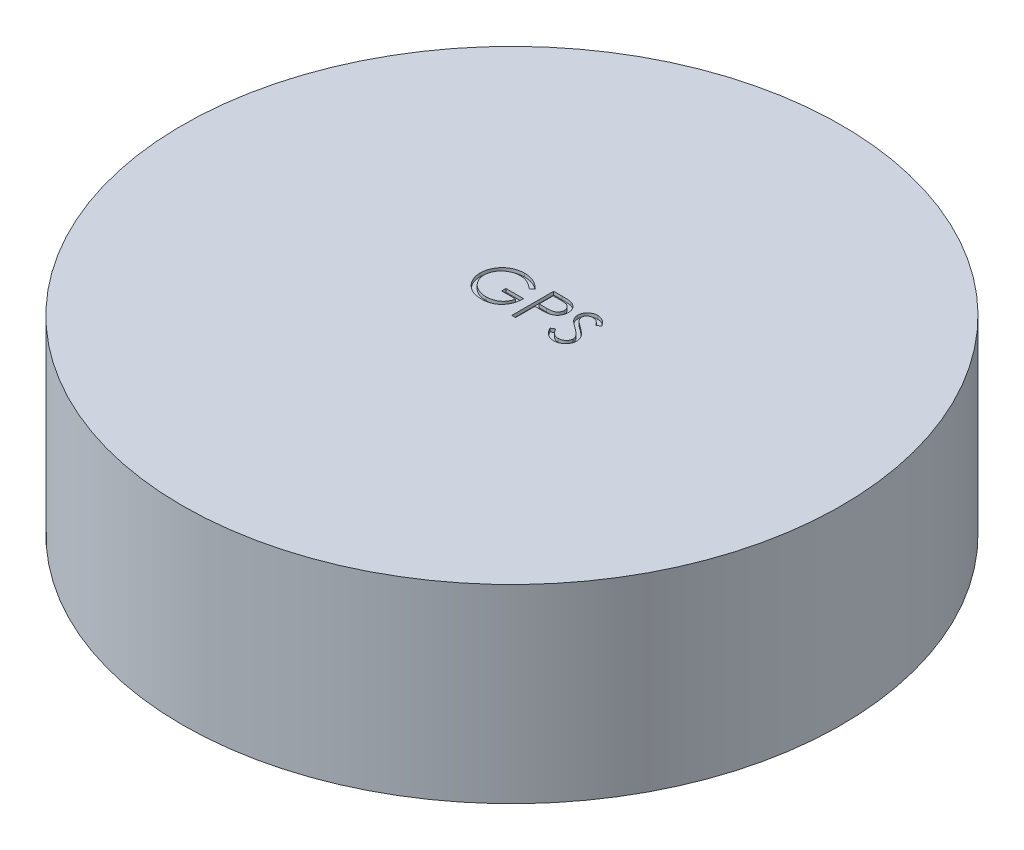
from build123d import *

# Parameters (mm, degrees)
SKETCH1_R           = 25
BOSS_EXTRUDE1_DEPTH = 14.4
CUT_EXTRUDE1_DEPTH  = 0.254


with BuildPart() as part:
    # Sketch1 → Boss-Extrude1 (new body)
    with BuildSketch(Plane(origin=(0, 0, 0), x_dir=(1, 0, 0), z_dir=(0, 1, 0))):
        Circle(SKETCH1_R)
    extrude(amount=BOSS_EXTRUDE1_DEPTH)

    # Sketch2 → Cut-Extrude1 (cut)
    # profile 1 of 3: a face of its own
    with BuildSketch(Plane(origin=(0, 14.4, 0), x_dir=(1, 0, 0), z_dir=(0, 1, 0))):
        with BuildLine():
            Line((-0.861858974, 2.633112981), (-1.106089744, 2.401602564))
            add(Edge.make_bspline(
                [(-1.106089744, 2.401602564), (-1.150284735, 2.443177704), (-1.237620863, 2.525336601), (-1.380006226, 2.631935861), (-1.528563237, 2.723254395), (-1.682516716, 2.797555052), (-1.838054118, 2.856839342), (-1.993110937, 2.899047012), (-2.14609668, 2.925964242), (-2.247848371, 2.92918312), (-2.297986779, 2.930769231)],
                knots=[0, 0, 0, 0, 1.08915593, 2.152340314, 3.188132944, 4.216796309, 5.218260357, 6.173443236, 7.099959455, 8, 8, 8, 8], degree=3))
            add(Edge.make_bspline(
                [(-2.297986779, 2.930769231), (-2.328752257, 2.930394031), (-2.390203421, 2.929644605), (-2.481481898, 2.920079495), (-2.571803062, 2.906322797), (-2.660996409, 2.88641838), (-2.749235362, 2.86119159), (-2.836213028, 2.829636205), (-2.922091657, 2.792846805), (-3.006062316, 2.750335847), (-3.087469773, 2.703636272), (-3.164356331, 2.651885096), (-3.237212057, 2.596740979), (-3.304667586, 2.536823305), (-3.367110934, 2.47267482), (-3.426028386, 2.405488821), (-3.47934779, 2.33342973), (-3.527509061, 2.257823341), (-3.570472815, 2.179997569), (-3.608399236, 2.1007015), (-3.640237309, 2.020198146), (-3.665428172, 1.93838649), (-3.686211408, 1.855899455), (-3.70083238, 1.772165887), (-3.709075335, 1.687096129), (-3.710501164, 1.630130045), (-3.711217949, 1.601492388)],
                knots=[0, 0, 0, 0, 1.02818874, 2.053710826, 3.065248034, 4.081641283, 5.106893873, 6.131558223, 7.173050175, 8.228653731, 9.27666206, 10.308777013, 11.325269123, 12.329503258, 13.32196095, 14.316845687, 15.314881793, 16.315733098, 17.311955233, 18.285320748, 19.252783886, 20.203351036, 21.145449891, 22.095197417, 23.042428769, 24, 24, 24, 24], degree=3))
            add(Edge.make_bspline(
                [(-3.711217949, 1.601492388), (-3.710532404, 1.572218146), (-3.709163187, 1.513749602), (-3.700399898, 1.426487836), (-3.684136422, 1.340522078), (-3.662394286, 1.255569843), (-3.635197404, 1.17148564), (-3.601295057, 1.088634006), (-3.561139833, 1.007018008), (-3.514660961, 0.927373027), (-3.463692048, 0.849791427), (-3.406593681, 0.776712433), (-3.345941581, 0.707162899), (-3.279526115, 0.642687027), (-3.209476958, 0.581560207), (-3.133701251, 0.525466555), (-3.053689019, 0.473325596), (-2.969318191, 0.425794467), (-2.881504238, 0.383332438), (-2.791464184, 0.345573618), (-2.69891038, 0.314477362), (-2.604329225, 0.289133511), (-2.507833472, 0.26835967), (-2.408933308, 0.254995206), (-2.308355922, 0.245297095), (-2.240557306, 0.244588008), (-2.20640024, 0.244230769)],
                knots=[0, 0, 0, 0, 0.93586088, 1.869166235, 2.799637598, 3.729985548, 4.670839027, 5.622275134, 6.589130586, 7.576015415, 8.568469353, 9.55398029, 10.53834874, 11.515998671, 12.510579167, 13.508179873, 14.527009472, 15.561807829, 16.601455013, 17.643573243, 18.680854198, 19.719860599, 20.772568776, 21.833555941, 22.908541556, 24, 24, 24, 24], degree=3))
            add(Edge.make_bspline(
                [(-2.20640024, 0.244230769), (-2.165235597, 0.245091263), (-2.084402131, 0.246780984), (-1.965578715, 0.259934818), (-1.851457358, 0.280478695), (-1.742358731, 0.310564901), (-1.63815612, 0.348940378), (-1.538467523, 0.395200478), (-1.444077804, 0.451119539), (-1.354703211, 0.514232975), (-1.272373478, 0.584550002), (-1.198120094, 0.660427472), (-1.1331274, 0.741497075), (-1.076426709, 0.827281326), (-1.029519572, 0.918490281), (-0.991017894, 1.014676963), (-0.961505551, 1.115884634), (-0.949390681, 1.185817757), (-0.943269231, 1.221153846)],
                knots=[0, 0, 0, 0, 1.13008108, 2.219097802, 3.278683437, 4.311054135, 5.322181354, 6.324827112, 7.324222904, 8.330512327, 9.32562643, 10.293043162, 11.24128371, 12.174520618, 13.111833804, 14.052305215, 15.015860969, 16, 16, 16, 16], degree=3))
            Line((-0.943269231, 1.221153846), (-2.001602564, 1.221153846))
            Line((-2.001602564, 1.221153846), (-2.001602564, 1.546794872))
            Line((-2.001602564, 1.546794872), (-0.658333333, 1.546794872))
            add(Edge.make_bspline(
                [(-0.658333333, 1.546794872), (-0.659880782, 1.486100221), (-0.662909417, 1.367309826), (-0.684153719, 1.194072509), (-0.718458698, 1.030449616), (-0.765321981, 0.876268829), (-0.825987414, 0.731748642), (-0.899803922, 0.59674232), (-0.987952917, 0.472122045), (-1.087294532, 0.356870449), (-1.198782351, 0.254064664), (-1.319403885, 0.163707849), (-1.44935842, 0.087596191), (-1.588523032, 0.025674018), (-1.736442139, -0.022653106), (-1.893458026, -0.056917322), (-2.059357764, -0.077445931), (-2.173056035, -0.080068825), (-2.231204928, -0.081410256)],
                knots=[0, 0, 0, 0, 1.140356446, 2.231883559, 3.274166699, 4.278491846, 5.25512956, 6.21435461, 7.1637429, 8.11826594, 9.068280886, 10.0076534, 10.945064095, 11.891975133, 12.864533718, 13.863980011, 14.907571808, 16, 16, 16, 16], degree=3))
            add(Edge.make_bspline(
                [(-2.231204928, -0.081410256), (-2.267046265, -0.080893982), (-2.337736933, -0.079875723), (-2.442140846, -0.072639129), (-2.543666117, -0.061498892), (-2.642297953, -0.044675816), (-2.738399164, -0.02407038), (-2.831489787, 0.00231543), (-2.921924439, 0.03285775), (-3.009842897, 0.067597396), (-3.094447165, 0.107848828), (-3.176114076, 0.152579715), (-3.255295062, 0.201559407), (-3.331450762, 0.25563496), (-3.404977975, 0.314401906), (-3.475402599, 0.377978032), (-3.543118889, 0.446168976), (-3.585537309, 0.494591364), (-3.606911058, 0.518990385)],
                knots=[0, 0, 0, 0, 1.107784379, 2.184907829, 3.233506516, 4.263428166, 5.276301166, 6.270063455, 7.25232949, 8.225834625, 9.190232166, 10.146266622, 11.1027726, 12.066435141, 13.031522626, 14.010570082, 14.99756817, 16, 16, 16, 16], degree=3))
            add(Edge.make_bspline(
                [(-3.606911058, 0.518990385), (-3.637922582, 0.557698763), (-3.69943087, 0.634473), (-3.778604627, 0.757481521), (-3.846097328, 0.884846065), (-3.900859566, 1.016921192), (-3.943620545, 1.153583364), (-3.974287645, 1.29465795), (-3.992255686, 1.440326615), (-3.994844252, 1.538901533), (-3.996153846, 1.588772035)],
                knots=[0, 0, 0, 0, 1.023165419, 2.029347347, 3.013907458, 3.994755782, 4.975994455, 5.96558838, 6.970761222, 8, 8, 8, 8], degree=3))
            add(Edge.make_bspline(
                [(-3.996153846, 1.588772035), (-3.99567103, 1.626115707), (-3.994711534, 1.700328436), (-3.983076959, 1.810507565), (-3.966384244, 1.918730336), (-3.941848702, 2.024908283), (-3.910918519, 2.12911232), (-3.872316428, 2.23139083), (-3.827372129, 2.331804171), (-3.775133858, 2.42966118), (-3.717000098, 2.523663326), (-3.653908113, 2.61343219), (-3.58496199, 2.697332985), (-3.511287657, 2.776428266), (-3.432006102, 2.849724363), (-3.347860053, 2.917899877), (-3.258784663, 2.98104626), (-3.1644997, 3.038168896), (-3.066412444, 3.08948018), (-2.964758014, 3.134464679), (-2.859567442, 3.171642401), (-2.751628801, 3.203187187), (-2.640125069, 3.226514493), (-2.525865403, 3.243431569), (-2.40825423, 3.255007256), (-2.328755832, 3.255938217), (-2.288446514, 3.256410256)],
                knots=[0, 0, 0, 0, 1.008945113, 2.00506715, 2.99143336, 3.967273523, 4.948097931, 5.927297278, 6.919902385, 7.919676788, 8.923139349, 9.905703106, 10.883022732, 11.856032218, 12.825136022, 13.798837087, 14.781400844, 15.773989409, 16.776158564, 17.77167057, 18.775803737, 19.789618931, 20.80898985, 21.851988756, 22.910860228, 24, 24, 24, 24], degree=3))
            add(Edge.make_bspline(
                [(-2.288446514, 3.256410256), (-2.255573251, 3.255884575), (-2.190389431, 3.254842209), (-2.093392517, 3.247617136), (-1.997894854, 3.236165472), (-1.903754843, 3.220538316), (-1.811293068, 3.199253397), (-1.720246128, 3.173782381), (-1.630482041, 3.144126228), (-1.54228213, 3.108757774), (-1.455053344, 3.068613415), (-1.368310675, 3.023425524), (-1.282350502, 2.972421413), (-1.197023754, 2.915449634), (-1.111792369, 2.853488677), (-1.028004443, 2.784766415), (-0.943637487, 2.711992915), (-0.889388698, 2.659666934), (-0.861858974, 2.633112981)],
                knots=[0, 0, 0, 0, 0.985871117, 1.954866573, 2.915460327, 3.869826059, 4.81536089, 5.759505086, 6.70452669, 7.649098992, 8.607881297, 9.583363685, 10.581137262, 11.603961102, 12.659522466, 13.73993555, 14.853081303, 16, 16, 16, 16], degree=3))
        make_face()
    # profile 2 of 3: a face of its own
    with BuildSketch(Plane(origin=(0, 14.4, 0), x_dir=(1, 0, 0), z_dir=(0, 1, 0))):
        with BuildLine():
            Line((-0.007051282, 3.175), (0.615609976, 3.175))
            add(Edge.make_bspline(
                [(0.615609976, 3.175), (0.658437012, 3.174952923), (0.740495516, 3.17486272), (0.858165602, 3.172127915), (0.965035859, 3.16847513), (1.060875847, 3.163411556), (1.14598045, 3.157427506), (1.219964572, 3.149034585), (1.283409741, 3.140271317), (1.321424877, 3.131361898), (1.338762019, 3.127298678)],
                knots=[0, 0, 0, 0, 1.415646017, 2.712440637, 3.8905458, 4.950247383, 5.884950622, 6.709939814, 7.411656543, 8, 8, 8, 8], degree=3))
            add(Edge.make_bspline(
                [(1.338762019, 3.127298678), (1.360709011, 3.121291623), (1.40408584, 3.109419063), (1.466588929, 3.085639471), (1.526055632, 3.057443507), (1.582689974, 3.025308933), (1.635796007, 2.987857028), (1.686166058, 2.946605961), (1.733355612, 2.900603324), (1.777099303, 2.850365081), (1.817271941, 2.796734605), (1.85186101, 2.738911296), (1.880823566, 2.677868471), (1.905664105, 2.613648589), (1.923542489, 2.545712367), (1.937010748, 2.474531849), (1.945559324, 2.400114666), (1.946378077, 2.349260357), (1.946794872, 2.323372396)],
                knots=[0, 0, 0, 0, 0.999701418, 1.975846123, 2.934577507, 3.890451536, 4.834027766, 5.787354733, 6.749476667, 7.726910423, 8.712836071, 9.690891519, 10.682875813, 11.679750201, 12.712814741, 13.765529915, 14.8625177, 16, 16, 16, 16], degree=3))
            add(Edge.make_bspline(
                [(1.946794872, 2.323372396), (1.946412579, 2.297266841), (1.945664598, 2.24618956), (1.936687254, 2.171465674), (1.924594866, 2.100056849), (1.906001111, 2.032121418), (1.881648251, 1.968062827), (1.85308046, 1.906902138), (1.818623971, 1.849679864), (1.779031876, 1.796188264), (1.734988644, 1.74637713), (1.686680621, 1.700607423), (1.634302835, 1.659147059), (1.578021743, 1.62190309), (1.517288666, 1.589739179), (1.453024712, 1.560930767), (1.384671302, 1.536736305), (1.337370593, 1.524009035), (1.313321314, 1.517538061)],
                knots=[0, 0, 0, 0, 1.121902311, 2.195077645, 3.232258892, 4.234102512, 5.217864754, 6.176164875, 7.132989551, 8.084763148, 9.034132444, 9.988522005, 10.94243251, 11.903244335, 12.886203696, 13.894208494, 14.929344452, 16, 16, 16, 16], degree=3))
            add(Edge.make_bspline(
                [(1.313321314, 1.517538061), (1.29343009, 1.513308071), (1.249837315, 1.504037802), (1.17804356, 1.493688702), (1.094454531, 1.484855307), (0.99918432, 1.478232132), (0.892318442, 1.472562155), (0.773799087, 1.468055384), (0.643393603, 1.465579017), (0.55243326, 1.465451298), (0.504942909, 1.465384615)],
                knots=[0, 0, 0, 0, 0.601384939, 1.31797006, 2.144135048, 3.087295005, 4.142315834, 5.309527816, 6.595305764, 8, 8, 8, 8], degree=3))
            Line((0.504942909, 1.465384615), (0.277884615, 1.465384615))
            Line((0.277884615, 1.465384615), (0.277884615, 0))
            Line((0.277884615, 0), (-0.007051282, 0))
            Line((-0.007051282, 0), (-0.007051282, 3.175))
        make_face()
        with BuildLine():
            Line((0.277884615, 2.849358974), (0.277884615, 1.791025641))
            Line((0.277884615, 1.791025641), (0.833764022, 1.784029447))
            add(Edge.make_bspline(
                [(0.833764022, 1.784029447), (0.860905669, 1.784015419), (0.913302059, 1.783988339), (0.988990633, 1.787603506), (1.059211915, 1.791776847), (1.123750209, 1.797887291), (1.182634606, 1.806524432), (1.235963293, 1.815243652), (1.283322757, 1.827857802), (1.338748462, 1.8448423), (1.400509784, 1.873809745), (1.467699632, 1.915855716), (1.524641521, 1.969450359), (1.573915975, 2.029709891), (1.613019165, 2.096746959), (1.641644958, 2.16847378), (1.658464436, 2.244154758), (1.660719769, 2.295941855), (1.661858974, 2.322100361)],
                knots=[0, 0, 0, 0, 1.160613943, 2.240541288, 3.23993089, 4.169200891, 5.011653406, 5.7853311, 6.478053781, 7.106038997, 8.262395093, 9.384106736, 10.481365981, 11.59014053, 12.70357646, 13.786202915, 14.881775077, 16, 16, 16, 16], degree=3))
            add(Edge.make_bspline(
                [(1.661858974, 2.322100361), (1.660713574, 2.347626012), (1.658436659, 2.398367848), (1.641513126, 2.472734295), (1.61307482, 2.543705256), (1.57365348, 2.609902269), (1.525809741, 2.669944969), (1.47020248, 2.722103078), (1.406962593, 2.764032765), (1.348135983, 2.791095813), (1.295883479, 2.80761967), (1.250497343, 2.819181061), (1.199252232, 2.82841179), (1.14213146, 2.835886196), (1.079577761, 2.842284693), (1.011053718, 2.846626258), (0.936818913, 2.849167579), (0.88528361, 2.849293631), (0.85856871, 2.849358974)],
                knots=[0, 0, 0, 0, 1.120700087, 2.227813068, 3.331159281, 4.466773991, 5.599788987, 6.693661531, 7.80175334, 8.91857717, 9.525282508, 10.207424825, 10.974604443, 11.810962634, 12.737642355, 13.736264703, 14.826523623, 16, 16, 16, 16], degree=3))
            Line((0.85856871, 2.849358974), (0.277884615, 2.849358974))
        make_face(mode=Mode.SUBTRACT)
    # profile 3 of 3: a face of its own
    with BuildSketch(Plane(origin=(0, 14.4, 0), x_dir=(1, 0, 0), z_dir=(0, 1, 0))):
        with BuildLine():
            Line((2.272435897, 0.612484976), (2.540835337, 0.773397436))
            add(Edge.make_bspline(
                [(2.540835337, 0.773397436), (2.565798309, 0.731610458), (2.613626401, 0.651548221), (2.693410848, 0.543364142), (2.776081417, 0.451414185), (2.862250313, 0.376233263), (2.951391566, 0.317043201), (3.0440871, 0.275131177), (3.140024543, 0.24899097), (3.205315081, 0.245815892), (3.237910657, 0.244230769)],
                knots=[0, 0, 0, 0, 1.272034388, 2.437168799, 3.508375237, 4.49857839, 5.41946034, 6.295179144, 7.148887113, 8, 8, 8, 8], degree=3))
            add(Edge.make_bspline(
                [(3.237910657, 0.244230769), (3.265748023, 0.245006079), (3.320935667, 0.246543133), (3.402181416, 0.261312147), (3.481086337, 0.284001721), (3.556024173, 0.316496423), (3.625960909, 0.355810621), (3.68728984, 0.403296082), (3.740308814, 0.456460283), (3.78367851, 0.515771691), (3.816952542, 0.57955939), (3.842526776, 0.645033288), (3.856719093, 0.713221918), (3.858857005, 0.759132838), (3.859935897, 0.782301683)],
                knots=[0, 0, 0, 0, 1.095163259, 2.171163733, 3.241058638, 4.321873601, 5.38011039, 6.391990106, 7.366004449, 8.327778327, 9.272591725, 10.192022065, 11.087607919, 12, 12, 12, 12], degree=3))
            add(Edge.make_bspline(
                [(3.859935897, 0.782301683), (3.858598487, 0.808736596), (3.855879727, 0.862474913), (3.832900456, 0.941758884), (3.796751496, 1.020220001), (3.763402527, 1.068753292), (3.746088742, 1.093950321)],
                knots=[0, 0, 0, 0, 0.938893495, 1.908633276, 2.914225137, 4, 4, 4, 4], degree=3))
            add(Edge.make_bspline(
                [(3.746088742, 1.093950321), (3.731873256, 1.112135653), (3.702029622, 1.150313485), (3.650723879, 1.207141663), (3.590520332, 1.2657598), (3.52347925, 1.32840623), (3.447158519, 1.392167303), (3.36394856, 1.460083527), (3.271724917, 1.5295721), (3.207046087, 1.576174356), (3.173672877, 1.600220353)],
                knots=[0, 0, 0, 0, 0.722233717, 1.516239348, 2.393582979, 3.351407094, 4.387010283, 5.505090956, 6.712668013, 8, 8, 8, 8], degree=3))
            add(Edge.make_bspline(
                [(3.173672877, 1.600220353), (3.140268251, 1.624013428), (3.076401152, 1.669503978), (2.987085152, 1.737017435), (2.907216247, 1.798742946), (2.837149424, 1.855261585), (2.776915504, 1.90658102), (2.726039839, 1.952208436), (2.685818433, 1.993377809), (2.6634523, 2.020085312), (2.653410457, 2.032076322)],
                knots=[0, 0, 0, 0, 1.452282411, 2.77665338, 3.964542531, 5.026858415, 5.96415736, 6.766646006, 7.446254459, 8, 8, 8, 8], degree=3))
            add(Edge.make_bspline(
                [(2.653410457, 2.032076322), (2.639374648, 2.050764406), (2.611771346, 2.08751703), (2.575335041, 2.144961722), (2.544365943, 2.203765684), (2.520088685, 2.264086933), (2.499645115, 2.325078618), (2.485894706, 2.387536534), (2.477284653, 2.451180424), (2.476402923, 2.494009814), (2.475961538, 2.51544972)],
                knots=[0, 0, 0, 0, 1.068054152, 2.10047183, 3.106115577, 4.101338837, 5.06977816, 6.043150881, 7.020423561, 8, 8, 8, 8], degree=3))
            add(Edge.make_bspline(
                [(2.475961538, 2.51544972), (2.477145549, 2.549041015), (2.479488264, 2.615505616), (2.499300733, 2.712597869), (2.530572573, 2.805295548), (2.574382935, 2.892680922), (2.630859248, 2.972478633), (2.696215239, 3.045606582), (2.774058516, 3.107082367), (2.859468396, 3.160796163), (2.952955247, 3.202838538), (3.050918424, 3.234553141), (3.153513625, 3.252522968), (3.223003612, 3.255101762), (3.258263221, 3.256410256)],
                knots=[0, 0, 0, 0, 1.005424448, 1.989358655, 2.955360095, 3.929531133, 4.905563448, 5.876582895, 6.856512386, 7.866279853, 8.892233794, 9.918561126, 10.94386622, 12, 12, 12, 12], degree=3))
            add(Edge.make_bspline(
                [(3.258263221, 3.256410256), (3.295677512, 3.255119799), (3.370082596, 3.252553491), (3.47952867, 3.230240016), (3.584903034, 3.193318692), (3.669669424, 3.151418981), (3.736011286, 3.109571197), (3.786605122, 3.071453213), (3.837874524, 3.027570079), (3.890233045, 2.977804906), (3.942793501, 2.921701067), (3.996336204, 2.8596428), (4.050986362, 2.792009352), (4.086143464, 2.743727127), (4.104166667, 2.718975361)],
                knots=[0, 0, 0, 0, 1.286793592, 2.559021753, 3.825965368, 5.121522368, 5.803751409, 6.523245864, 7.299691795, 8.125521123, 9.008227632, 9.944561021, 10.946284179, 12, 12, 12, 12], degree=3))
            Line((4.104166667, 2.718975361), (3.846579527, 2.523717949))
            add(Edge.make_bspline(
                [(3.846579527, 2.523717949), (3.831025717, 2.543755546), (3.801072715, 2.582343275), (3.755598109, 2.636382968), (3.712736836, 2.685746489), (3.670508973, 2.728622712), (3.63114475, 2.767359647), (3.592938576, 2.80052457), (3.556440272, 2.828442431), (3.510432789, 2.858236232), (3.452631716, 2.887769632), (3.380074315, 2.912760581), (3.304249623, 2.927778387), (3.252606314, 2.929764021), (3.22646234, 2.930769231)],
                knots=[0, 0, 0, 0, 1.181633172, 2.275549214, 3.290209073, 4.226197932, 5.078386478, 5.862611352, 6.581680152, 7.217281963, 8.414376989, 9.595101626, 10.782541182, 12, 12, 12, 12], degree=3))
            add(Edge.make_bspline(
                [(3.22646234, 2.930769231), (3.193663209, 2.929670046), (3.130413174, 2.927550371), (3.040614889, 2.904400099), (2.959793971, 2.867949411), (2.890349858, 2.816863681), (2.832531315, 2.756338209), (2.790707077, 2.686688819), (2.765533714, 2.609779068), (2.762461874, 2.556129137), (2.760897436, 2.52880609)],
                knots=[0, 0, 0, 0, 1.14458467, 2.207223713, 3.21896685, 4.227309161, 5.202851033, 6.127160689, 7.046193047, 8, 8, 8, 8], degree=3))
            add(Edge.make_bspline(
                [(2.760897436, 2.52880609), (2.761254058, 2.51179582), (2.761967885, 2.477747465), (2.771923594, 2.427445104), (2.7847137, 2.377269817), (2.804981659, 2.327447189), (2.832962756, 2.277105877), (2.869706737, 2.225379015), (2.915983098, 2.17181068), (2.951431531, 2.136969705), (2.970147236, 2.11857472)],
                knots=[0, 0, 0, 0, 0.858281714, 1.717966888, 2.583508476, 3.4729293, 4.427298488, 5.488583878, 6.674047936, 8, 8, 8, 8], degree=3))
            add(Edge.make_bspline(
                [(2.970147236, 2.11857472), (2.977097195, 2.11237256), (2.993608707, 2.09763765), (3.023794726, 2.073514653), (3.063657121, 2.043757852), (3.112154975, 2.006939358), (3.17018251, 1.964229746), (3.237746108, 1.916175112), (3.314092641, 1.861215445), (3.36826895, 1.822791105), (3.396915064, 1.802473958)],
                knots=[0, 0, 0, 0, 0.420754252, 0.999615792, 1.744751191, 2.668019286, 3.750313428, 4.999500688, 6.413464383, 8, 8, 8, 8], degree=3))
            add(Edge.make_bspline(
                [(3.396915064, 1.802473958), (3.431373714, 1.777399296), (3.498098114, 1.728845689), (3.59303749, 1.655897179), (3.67911973, 1.584552418), (3.756647065, 1.515267017), (3.826385403, 1.448566533), (3.88756105, 1.383648505), (3.940797345, 1.320978021), (3.998109922, 1.240630042), (4.056673087, 1.141950058), (4.106966454, 1.021047656), (4.13867867, 0.899675279), (4.142825687, 0.818098792), (4.144871795, 0.777849559)],
                knots=[0, 0, 0, 0, 1.163667725, 2.253281268, 3.268753668, 4.215851969, 5.092017293, 5.902905408, 6.650798638, 7.335211899, 8.59617414, 9.77448103, 10.901945474, 12, 12, 12, 12], degree=3))
            add(Edge.make_bspline(
                [(4.144871795, 0.777849559), (4.144275677, 0.7493849), (4.143095017, 0.693008344), (4.129523331, 0.610226953), (4.109639063, 0.529826093), (4.079669572, 0.452799584), (4.043090707, 0.377738263), (3.996675611, 0.306611097), (3.942875068, 0.237843864), (3.881158724, 0.173270268), (3.813625656, 0.113991933), (3.742248304, 0.06126057), (3.666909842, 0.017292877), (3.588018969, -0.018585387), (3.505557564, -0.046646507), (3.41955336, -0.066978181), (3.329864589, -0.079456576), (3.268904152, -0.080751759), (3.237910657, -0.081410256)],
                knots=[0, 0, 0, 0, 0.983748083, 1.948392443, 2.894712957, 3.844097841, 4.80183111, 5.778335162, 6.776009319, 7.81870978, 8.863265674, 9.881300176, 10.883814829, 11.87499822, 12.874611388, 13.892143829, 14.928324115, 16, 16, 16, 16], degree=3))
            add(Edge.make_bspline(
                [(3.237910657, -0.081410256), (3.213930024, -0.080946542), (3.166270771, -0.080024952), (3.095777169, -0.071877648), (3.026707685, -0.06035049), (2.959929015, -0.042049726), (2.894580791, -0.019845611), (2.830947229, 0.007494162), (2.768997487, 0.040257623), (2.708384394, 0.07771811), (2.649262107, 0.12131335), (2.592185161, 0.172089307), (2.535280828, 0.228645587), (2.48022869, 0.292518026), (2.425915195, 0.362674716), (2.373411209, 0.439772046), (2.321629937, 0.523390074), (2.289140191, 0.582231974), (2.272435897, 0.612484976)],
                knots=[0, 0, 0, 0, 0.915332311, 1.819136955, 2.706846663, 3.586547465, 4.459518054, 5.340707479, 6.227863349, 7.133153174, 8.059268498, 9.028702269, 10.047606654, 11.120612155, 12.245963614, 13.433783089, 14.680604001, 16, 16, 16, 16], degree=3))
        make_face()
    extrude(amount=-CUT_EXTRUDE1_DEPTH, mode=Mode.SUBTRACT)


solid = part.part
